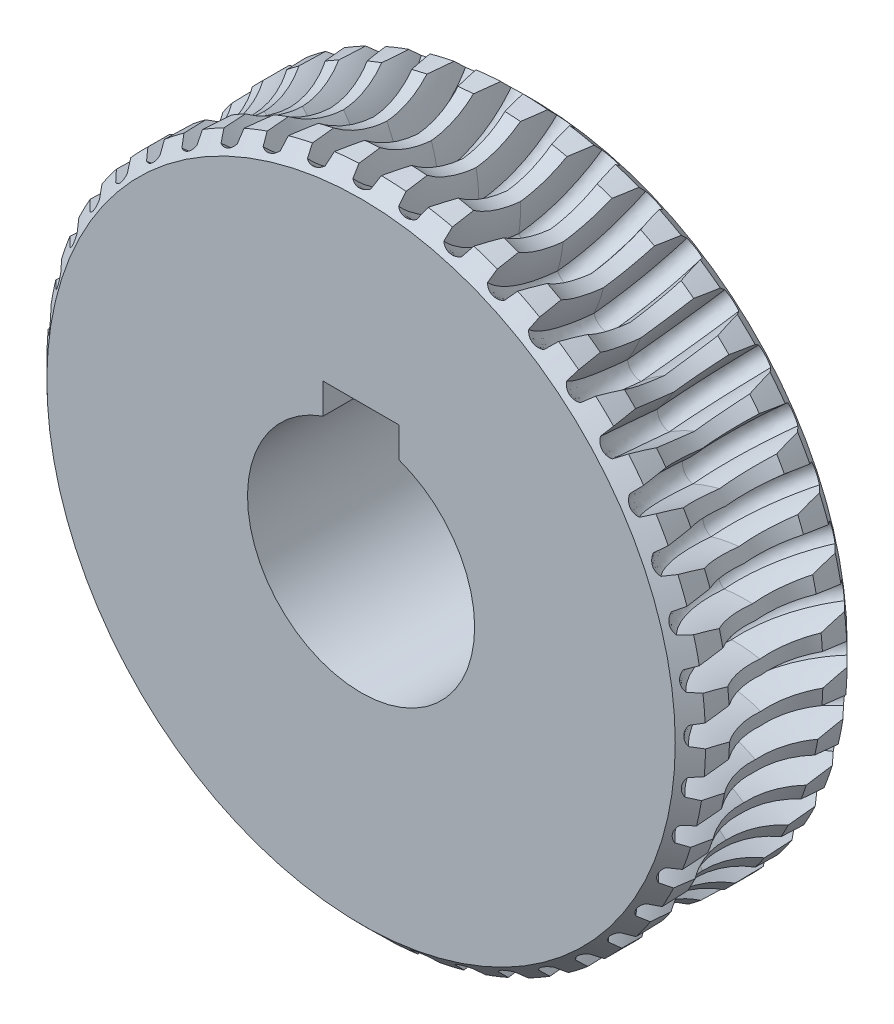
from build123d import *

# Parameters (mm, degrees)
SKETCH1_R              = 43.5
BOSS_EXTRUDE1_DEPTH    = 11.35
CHAMFER1_SIZE          = 2
SKETCH2_R              = 10.5
CUT_SWEEP1_PITCH       = 6
CUT_SWEEP1_HEIGHT      = 1.5
CUT_SWEEP1_RADIUS      = 10.5
CUT_SWEEP1_START_ANGLE = -90
CUT_SWEEP2_PITCH       = 6
CUT_SWEEP2_HEIGHT      = 1.5
CUT_SWEEP2_RADIUS      = 10.5
CUT_SWEEP2_START_ANGLE = -90
CIRPATTERN1_COUNT      = 44


with BuildPart() as part:
    # Sketch1 → Boss-Extrude1 (new, symmetric)
    with BuildSketch(Plane.XY):
        Circle(SKETCH1_R)
        with BuildLine():
            Line((-5, 18.142135624), (5, 18.142135624))
            Line((5, 18.142135624), (5, 14.142135624))
            ThreePointArc((5, 14.142135624), (0, -15), (-5, 14.142135624))
            Line((-5, 14.142135624), (-5, 18.142135624))
        make_face(mode=Mode.SUBTRACT)
    extrude(amount=BOSS_EXTRUDE1_DEPTH, both=True)

    # Chamfer1
    chamfer1_edges = [part.edges().sort_by_distance(p)[0] for p in [
        (-43.5, 0, -11.35),
        (-43.5, 0, 11.35),
    ]]
    chamfer(chamfer1_edges, length=CHAMFER1_SIZE)

    # Sketch2 → Cut-Revolve1 (revolve, cut)
    with BuildSketch(Plane(origin=(0, 0, 0), x_dir=(0, 0, -1), z_dir=(1, 0, 0)), mode=Mode.PRIVATE) as cut_revolve1_sk:
        with Locations((0, -52)):
            Circle(SKETCH2_R)
    revolve(cut_revolve1_sk.sketch.rotate(Axis((0, 0, 0), (0, 0, -1)), 270), axis=Axis((0, 0, 0), (0, 0, -1)), mode=Mode.SUBTRACT)

    # Cut-Sweep1: sweep along a helix
    with BuildLine() as cut_sweep1_path:
        add(Helix(CUT_SWEEP1_PITCH, CUT_SWEEP1_HEIGHT, CUT_SWEEP1_RADIUS, center=(0, -52, 0), direction=(1, 0, 0), mode=Mode.PRIVATE).rotate(Axis((0, -52, 0), (1, 0, 0)), CUT_SWEEP1_START_ANGLE))
    # Sketch4 → Cut-Sweep1 (sweep, cut)
    with BuildSketch(Plane.XY):
        with BuildLine():
            Line((3.45, -45.44), (-3.45, -45.44))
            Line((-3.45, -45.44), (-3.45, -44.44))
            ThreePointArc((-3.45, -44.44), (-1.998598963, -41.225656186), (-1.201831935, -37.79))
            ThreePointArc((-1.201831935, -37.79), (0, -37.33), (1.201831935, -37.79))
            ThreePointArc((1.201831935, -37.79), (1.998598963, -41.225656186), (3.45, -44.44))
            Line((3.45, -44.44), (3.45, -45.44))
        make_face()
    cut_sweep1 = sweep(path=cut_sweep1_path.line, is_frenet=True, mode=Mode.SUBTRACT)

    # Cut-Sweep2: sweep along a helix
    with BuildLine() as cut_sweep2_path:
        add(Helix(CUT_SWEEP2_PITCH, CUT_SWEEP2_HEIGHT, CUT_SWEEP2_RADIUS, center=(0, -52, 0), direction=(1, 0, 0), lefthand=True, mode=Mode.PRIVATE).rotate(Axis((0, -52, 0), (1, 0, 0)), CUT_SWEEP2_START_ANGLE))
    # Sketch4<2> → Cut-Sweep2 (sweep, cut)
    with BuildSketch(Plane.XY):
        with BuildLine():
            Line((3.45, -45.44), (-3.45, -45.44))
            Line((-3.45, -45.44), (-3.45, -44.44))
            ThreePointArc((-3.45, -44.44), (-1.998598963, -41.225656186), (-1.201831935, -37.79))
            ThreePointArc((-1.201831935, -37.79), (0, -37.33), (1.201831935, -37.79))
            ThreePointArc((1.201831935, -37.79), (1.998598963, -41.225656186), (3.45, -44.44))
            Line((3.45, -44.44), (3.45, -45.44))
        make_face()
    cut_sweep2 = sweep(path=cut_sweep2_path.line, is_frenet=True, mode=Mode.SUBTRACT)

    # CirPattern1: Cut-Sweep1, Cut-Sweep2 ×44 about axis
    cirpattern1_axis = Axis((0, 0, 11.35), (0, 0, 1))
    add([cut_sweep1.rotate(cirpattern1_axis, i * 360 / CIRPATTERN1_COUNT) for i in range(1, CIRPATTERN1_COUNT)], mode=Mode.SUBTRACT)
    add([cut_sweep2.rotate(cirpattern1_axis, i * 360 / CIRPATTERN1_COUNT) for i in range(1, CIRPATTERN1_COUNT)], mode=Mode.SUBTRACT)


solid = part.part
